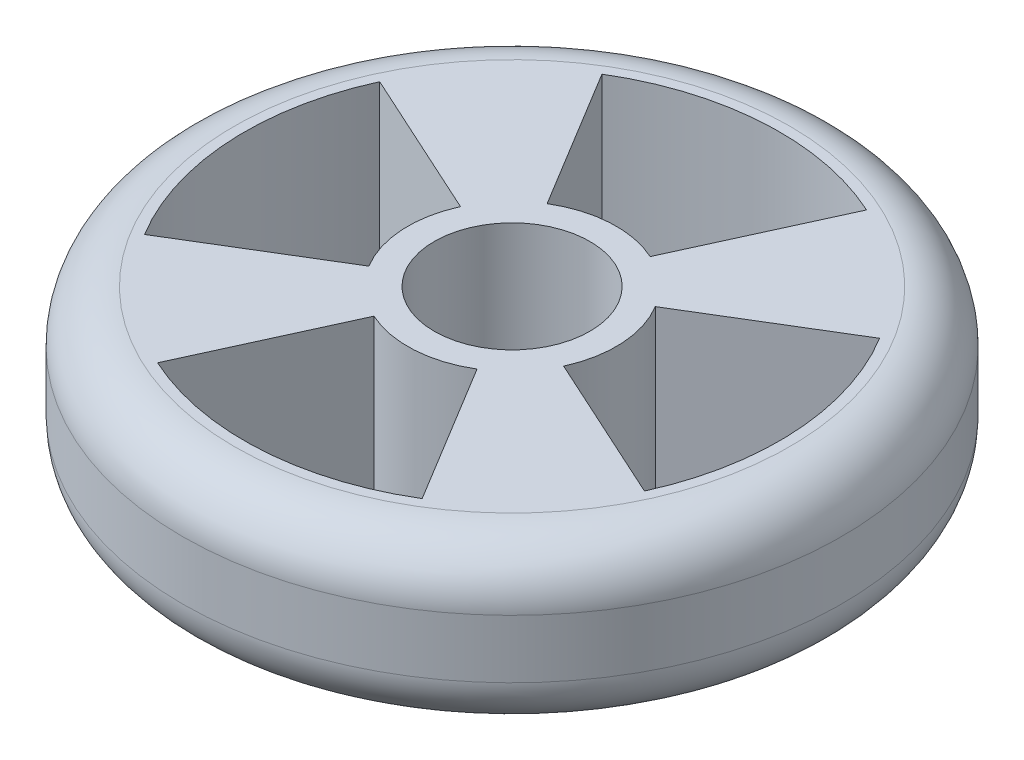
from build123d import *

# Parameters (mm, degrees)
SKETCH1_R           = 50.8
BOSS_EXTRUDE1_DEPTH = 25
FILLET2_R           = 8
FILLET3_R           = 8
SKETCH2_R           = 15
BOSS_EXTRUDE2_DEPTH = 5
SKETCH3_R           = 12
CUT_EXTRUDE1_DEPTH  = 25
FILLET4_R           = 8
SKETCH5_R           = 1.61
SKETCH5_R_2         = 4.2
CUT_EXTRUDE2_DEPTH  = 78.85422275
CUT_EXTRUDE3_DEPTH  = 78.85422275
SKETCH7_R           = 3.4
CUT_EXTRUDE4_DEPTH  = 2.3


with BuildPart() as part:
    # Sketch1 → Boss-Extrude1 (new body)
    with BuildSketch(Plane(origin=(0, 0, 0), x_dir=(1, 0, 0), z_dir=(0, 1, 0))):
        with Locations(Location((0, 0, 0), (0, 0, 270))):
            Circle(SKETCH1_R)
    extrude(amount=BOSS_EXTRUDE1_DEPTH)

    # Fillet2
    fillet2_edges = [part.edges().sort_by_distance(p)[0] for p in [
        (0, 25, -50.8),
    ]]
    fillet(fillet2_edges, radius=FILLET2_R)

    # Fillet3
    fillet3_edges = [part.edges().sort_by_distance(p)[0] for p in [
        (0, 0, -50.8),
    ]]
    fillet(fillet3_edges, radius=FILLET3_R)

    # Sketch2 → Boss-Extrude2 (add)
    with BuildSketch(Plane.XZ):
        with Locations(Location((0, 0, 0), (0, 0, 90))):
            Circle(SKETCH2_R)
    extrude(amount=BOSS_EXTRUDE2_DEPTH)

    # Sketch3 → Cut-Extrude1 (cut)
    with BuildSketch(Plane(origin=(0, 25, 0), x_dir=(1, 0, 0), z_dir=(0, 1, 0))):
        with Locations(Location((0, 0, 0), (0, 0, 270))):
            Circle(SKETCH3_R)
    extrude(amount=-CUT_EXTRUDE1_DEPTH, mode=Mode.SUBTRACT)

    # Fillet4
    # the kernel refuses this fillet: 8 mm, written as the material it adds along each edge
    with BuildSketch(Plane(origin=(0, 0, 0), x_dir=(0, 0, 1), z_dir=(1, 0, 0))) as fillet4_piece_1:
        with BuildLine():
            CenterArc((22.416198487, 8), FILLET4_R, 202.024312837, 67.975687163)
            Line((15, 5), (14.85167603, 4.94))
            ThreePointArc((14.85167603, 4.94), (14.84, 2.5), (14.84, 0))
            Line((14.84, 0), (15, -0.16))
            Line((15, -0.16), (22.416198487, -0.16))
            Line((22.416198487, -0.16), (22.416198487, 0))
        make_face()
    revolve(axis=Axis((0, 0, 0), (0, -1, 0)))

    # Sketch5 → Cut-Extrude2 (cut, through all)
    with BuildSketch(Plane.XZ.offset(5)):
        with Locations(Location((0, 8, 0), (0, 0, 270))):
            Circle(SKETCH5_R)
        with Locations(Location((0, -8, 0), (0, 0, 90))):
            Circle(SKETCH5_R)
        with Locations(Location((8, 0, 0), (0, 0, 270))):
            Circle(SKETCH5_R)
        with Locations(Location((-8, 0, 0), (0, 0, 90))):
            Circle(SKETCH5_R)
        with Locations(Location((0, 0, 0), (0, 0, 270))):
            Circle(SKETCH5_R_2)
    extrude(amount=-CUT_EXTRUDE2_DEPTH, mode=Mode.SUBTRACT)

    # Sketch6 → Cut-Extrude3 (cut, through all)
    with BuildSketch(Plane(origin=(0, 25, 0), x_dir=(1, 0, 0), z_dir=(0, 1, 0))):
        with BuildLine():
            Line((6.669640143, 14.619160774), (17.119775233, 37.524775128))
            ThreePointArc((17.119775233, 37.524775128), (-2.42176691, 41.174391282), (-21.4007271, 35.259102825))
            Line((-21.4007271, 35.259102825), (-8.337442905, 13.736484528))
            ThreePointArc((-8.337442905, 13.736484528), (-0.943488661, 16.041003414), (6.669640143, 14.619160774))
        make_face()
        with BuildLine():
            Line((13.736484528, 8.337442905), (35.259102825, 21.4007271))
            ThreePointArc((35.259102825, 21.4007271), (41.174391282, 2.42176691), (37.524775128, -17.119775233))
            Line((37.524775128, -17.119775233), (14.619160774, -6.669640143))
            ThreePointArc((14.619160774, -6.669640143), (16.041003414, 0.943488661), (13.736484528, 8.337442905))
        make_face()
        with BuildLine():
            Line((8.337442905, -13.736484528), (21.4007271, -35.259102825))
            ThreePointArc((21.4007271, -35.259102825), (2.42176691, -41.174391282), (-17.119775233, -37.524775128))
            Line((-17.119775233, -37.524775128), (-6.669640143, -14.619160774))
            ThreePointArc((-6.669640143, -14.619160774), (0.943488661, -16.041003414), (8.337442905, -13.736484528))
        make_face()
        with BuildLine():
            Line((-13.736484528, -8.337442905), (-35.259102825, -21.4007271))
            ThreePointArc((-35.259102825, -21.4007271), (-41.174391282, -2.42176691), (-37.524775128, 17.119775233))
            Line((-37.524775128, 17.119775233), (-14.619160774, 6.669640143))
            ThreePointArc((-14.619160774, 6.669640143), (-16.041003414, -0.943488661), (-13.736484528, -8.337442905))
        make_face()
    extrude(amount=-CUT_EXTRUDE3_DEPTH, mode=Mode.SUBTRACT)

    # Sketch7 → Cut-Extrude4 (cut)
    with BuildSketch(Plane(origin=(0, 0, 0), x_dir=(1, 0, 0), z_dir=(0, 1, 0))):
        with Locations(Location((-8, 0, 0), (0, 0, 270))):
            Circle(SKETCH7_R)
        with Locations(Location((0, 8, 0), (0, 0, 270))):
            Circle(SKETCH7_R)
        with Locations(Location((8, 0, 0), (0, 0, 270))):
            Circle(SKETCH7_R)
        with Locations(Location((0, -8, 0), (0, 0, 270))):
            Circle(SKETCH7_R)
    extrude(amount=-CUT_EXTRUDE4_DEPTH, mode=Mode.SUBTRACT)


solid = part.part
